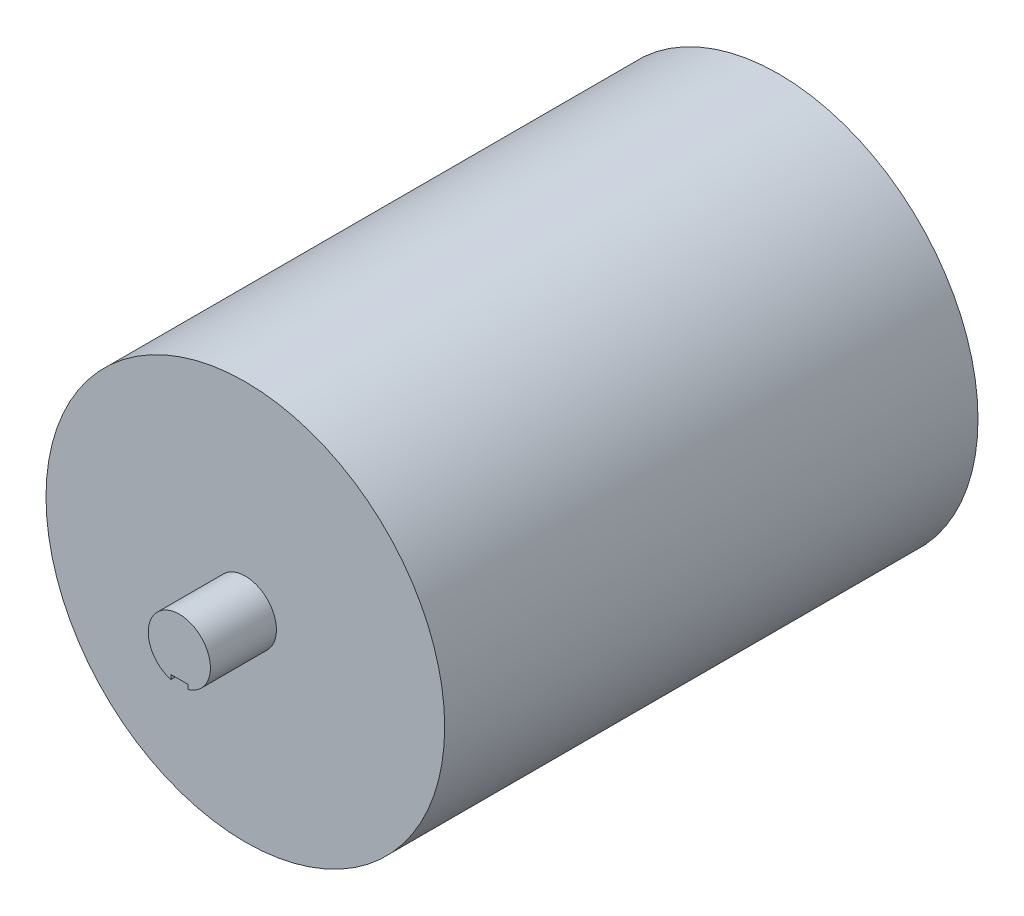
from build123d import *

# Parameters (mm, degrees)
SKETCH1_R           = 38.5
BOSS_EXTRUDE1_DEPTH = 103
SKETCH3_W           = 12.745768033
SKETCH3_H           = 6
SKETCH6_R           = 5
BOSS_EXTRUDE3_DEPTH = 12
CUT_EXTRUDE1_DEPTH  = 13


with BuildPart() as part:
    # Sketch1 → Boss-Extrude1 (new body)
    with BuildSketch(Plane.XY):
        Circle(SKETCH1_R)
    extrude(amount=BOSS_EXTRUDE1_DEPTH)

    # Sketch3 → Revolve1 (revolve)
    with BuildSketch(Plane(origin=(0, 0, 0), x_dir=(0, 0, -1), z_dir=(1, 0, 0))):
        with Locations((-109.372884016, -3)):
            Rectangle(SKETCH3_W, SKETCH3_H)
    revolve(axis=Axis((0, 0, 115.745768033), (0, 0, -1)))

    # Sketch6 → Boss-Extrude3 (add)
    with BuildSketch(Plane(origin=(0, 0, 0), x_dir=(-1, 0, 0), z_dir=(0, 0, -1))):
        Circle(SKETCH6_R)
    extrude(amount=BOSS_EXTRUDE3_DEPTH)

    # Sketch7 → Cut-Extrude1 (cut)
    with BuildSketch(Plane.XY.offset(115.745768033)):
        with BuildLine():
            Line((0, -4.9), (1.65, -4.9))
            Line((1.65, -4.9), (1.65, -5.768665357))
            ThreePointArc((1.65, -5.768665357), (0, -6), (-1.65, -5.768665357))
            Line((-1.65, -5.768665357), (-1.65, -4.9))
            Line((-1.65, -4.9), (0, -4.9))
        make_face()
    extrude(amount=-CUT_EXTRUDE1_DEPTH, mode=Mode.SUBTRACT)


solid = part.part
